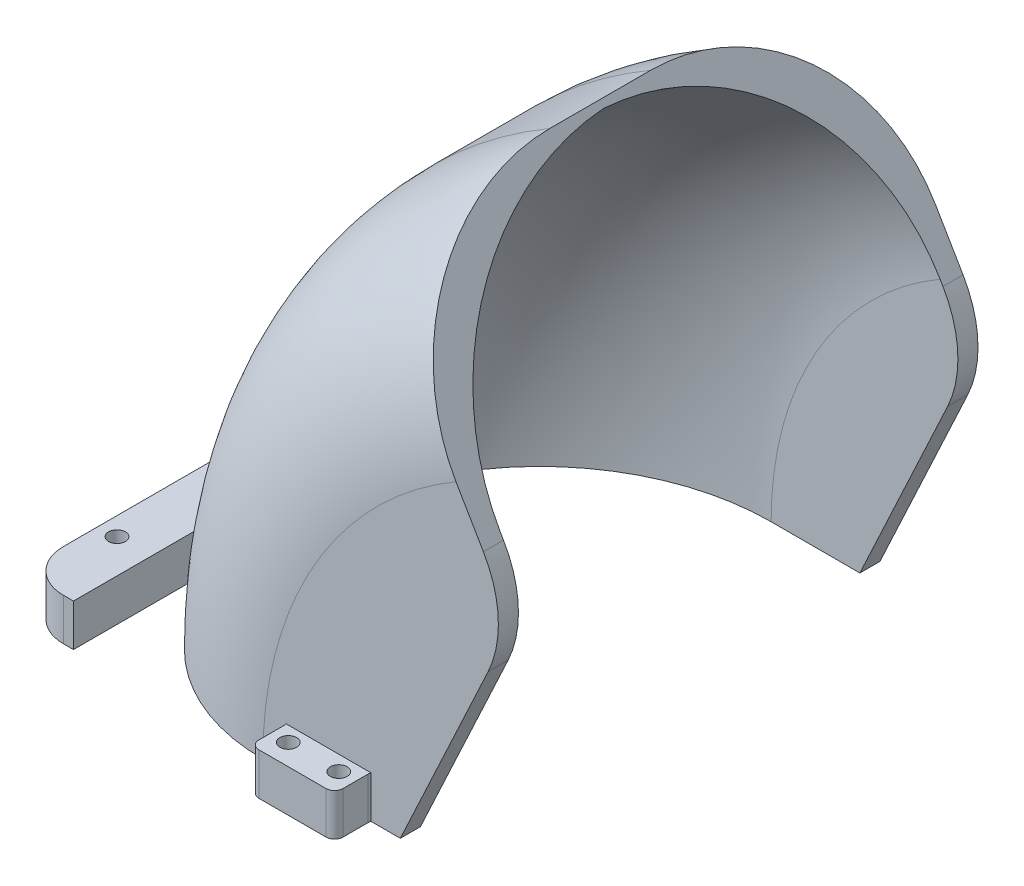
from build123d import *

# Parameters (mm, degrees)
BOSS_EXTRUDE1_DEPTH = 104.45
BOSS_EXTRUDE2_DEPTH = 4.7752
BOSS_EXTRUDE3_START = 4.7752
BOSS_EXTRUDE3_DEPTH = 4.7752
SKETCH4_R           = 1.9999999999999967
SKETCH4_R_2         = 1.9999999999999962
BOSS_EXTRUDE4_DEPTH = 10
FILLET1_R           = 10
FILLET3_R           = 55
FILLET4_R           = 45
CHAMFER1_SIZE       = 60.00000000000001
CHAMFER1_SIZE2      = 66.13522872048569
FILLET5_R           = 26


with BuildPart() as part:
    # Sketch1 → Boss-Extrude1 (new body)
    with BuildSketch(Plane.XY):
        with BuildLine():
            Line((-137.69000000000003, 0), (-136.1, 0))
            ThreePointArc((-136.1, 0), (-118.0490106345522, 67.73212744483506), (-68.68426027621781, 117.49758461478588))
            Line((-68.68426027621781, 117.49758461478588), (-69.48667007665269, 118.87026029103507))
            ThreePointArc((-69.48667007665269, 118.87026029103507), (-119.42812839288389, 68.52341387126629), (-137.69000000000003, 0))
        make_face()
    extrude(amount=BOSS_EXTRUDE1_DEPTH)

    # Sketch2 → Boss-Extrude2 (add)
    with BuildSketch(Plane.XY.offset(104.45)):
        with BuildLine():
            Line((-137.69000000000003, 1.686e-14), (0, 0))
            Line((0, 0), (-69.48667007665271, 118.87026029103507))
            ThreePointArc((-69.48667007665271, 118.87026029103507), (-119.42812839288392, 68.5234138712663), (-137.69000000000003, 1.686e-14))
        make_face()
    extrude(amount=BOSS_EXTRUDE2_DEPTH)

    # Sketch3 → Boss-Extrude3 (add)
    with BuildSketch(Plane(origin=(0, 0, 0), x_dir=(-1, 0, 0), z_dir=(0, 0, -1)).offset(BOSS_EXTRUDE3_START)):
        with BuildLine():
            Line((0, 0), (137.69000000000003, 1.686e-14))
            ThreePointArc((137.69000000000003, 1.686e-14), (119.42812839288389, 68.52341387126629), (69.4866700766527, 118.87026029103508))
            Line((69.4866700766527, 118.87026029103508), (0, 0))
        make_face()
    extrude(amount=-BOSS_EXTRUDE3_DEPTH)

    # Sketch4 → Boss-Extrude4 (add)
    # profile 1 of 5: a face of its own
    with BuildSketch(Plane.XZ):
        with BuildLine():
            Line((-137.69000000000003, 6.328766650845793), (-137.69000000000003, 109.2252))
            Line((-137.69000000000003, 109.2252), (-150.10000000000002, 109.2252))
            Line((-150.10000000000002, 109.2252), (-150.10000000000002, 10.475690213138677))
            ThreePointArc((-150.10000000000002, 10.475690213138678), (-142.97351570054127, 11.159843802640754), (-137.69000000000005, 6.32876665084579))
        make_face()
        with Locations(Location((-145.76703973293544, 18.800000000059715, 0), (0, 0, 270))):
            Circle(SKETCH4_R, mode=Mode.SUBTRACT)
        with Locations(Location((-145.76703973293542, 66.8000000000597, 0), (0, 0, 270))):
            Circle(SKETCH4_R, mode=Mode.SUBTRACT)
        with Locations(Location((-145.7670397329354, 90.80000000005973, 0), (0, 0, 270))):
            Circle(SKETCH4_R, mode=Mode.SUBTRACT)
    # profile 2 of 5: a face of its own
    with BuildSketch(Plane.XZ):
        with BuildLine():
            ThreePointArc((-87.05969357051328, 109.79869615131716), (-87.0808016736092, 109.50888942519616), (-87.14368092736706, 109.22519999999997))
            Line((-87.14368092736706, 109.2252), (-66.97531486918743, 109.2252))
            ThreePointArc((-66.97531486918743, 109.22520000000003), (-67.03848645979555, 109.50951987797353), (-67.05969357051326, 109.80000000005735))
            Line((-67.05969357051326, 109.80000000005735), (-67.05969357051326, 115.80000000005734))
            ThreePointArc((-67.05969357051328, 115.80000000005734), (-67.64548000814017, 117.21421356243043), (-69.05969357051326, 117.80000000005734))
            Line((-69.05969357051326, 117.80000000005734), (-85.05969357051326, 117.80000000005734))
            ThreePointArc((-85.05969357051326, 117.80000000005734), (-86.47390713288635, 117.21421356243043), (-87.05969357051328, 115.80000000005734))
            Line((-87.05969357051328, 115.80000000005734), (-87.05969357051328, 109.79869615131716))
        make_face()
        with Locations(Location((-83.05969357051332, 112.8000000000573, 0), (0, 0, 270))):
            Circle(SKETCH4_R, mode=Mode.SUBTRACT)
        with Locations(Location((-71.05969357051333, 112.8000000000573, 0), (0, 0, 270))):
            Circle(SKETCH4_R, mode=Mode.SUBTRACT)
    # profile 3 of 5: a face of its own
    with BuildSketch(Plane.XZ):
        with BuildLine():
            Line((-137.69000000000003, -0.7287666507264419), (-137.69000000000003, 6.328766650845793))
            ThreePointArc((-137.69000000000005, 6.32876665084579), (-142.97351570054127, 11.159843802640754), (-150.10000000000002, 10.475690213138678))
            Line((-150.10000000000002, 10.475690213138677), (-150.10000000000002, -1.9248000000000047))
            Line((-150.10000000000002, -1.9248000000000043), (-138.32613724180214, -1.9248000000000043))
            ThreePointArc((-138.32613724180214, -1.924799999999971), (-137.98505690973883, -1.3390226215975511), (-137.69000000000005, -0.7287666507264476))
        make_face()
    # profile 4 of 5: a face of its own
    with BuildSketch(Plane.XZ):
        with BuildLine():
            add(Edge.make_bspline(
                [(-89.04570479198645, -6.19874157019467), (-88.86578961884237, -6.199999999942648), (-88.685869728687, -6.199999999942648)],
                knots=[4.705147792502203, 4.705147792502203, 4.705147792502203, 4.71238898038469, 4.71238898038469, 4.71238898038469], degree=2, weights=[1, 0.9999934456569163, 1]))
            Line((-88.685869728687, -6.199999999942648), (-65.0596935705133, -6.1999999999426825))
            ThreePointArc((-65.0596935705133, -6.1999999999426825), (-66.47390713288638, -6.7857864375695796), (-67.0596935705133, -8.199999999942657))
            Line((-67.0596935705133, -8.199999999942657), (-67.0596935705133, -14.199999999942719))
            ThreePointArc((-67.0596935705133, -14.199999999942719), (-67.64548000814021, -15.614213562315815), (-69.0596935705133, -16.19999999994272))
            Line((-69.0596935705133, -16.19999999994272), (-85.05969357051329, -16.199999999942712))
            ThreePointArc((-85.05969357051329, -16.199999999942712), (-86.4739071328864, -15.614213562315818), (-87.0596935705133, -14.199999999942714))
            Line((-87.0596935705133, -14.199999999942714), (-87.0596935705133, -8.19869615120245))
            ThreePointArc((-87.0596935705133, -8.19869615120245), (-87.64054213015943, -6.789435301837706), (-89.04570479198645, -6.19874157019467))
        make_face()
        with Locations(Location((-83.05969357051332, -11.199999999942742, 0), (0, 0, 270))):
            Circle(SKETCH4_R_2, mode=Mode.SUBTRACT)
        with Locations(Location((-71.05969357051333, -11.199999999942742, 0), (0, 0, 269.999999999))):
            Circle(SKETCH4_R_2, mode=Mode.SUBTRACT)
    # profile 5 of 5: a face of its own
    with BuildSketch(Plane.XZ):
        with BuildLine():
            Line((-66.97531486918743, 109.2252), (-87.14368092736706, 109.2252))
            ThreePointArc((-87.14368092736706, 109.22519999999997), (-87.85972630188988, 108.19866898049219), (-89.04570479198642, 107.79874157030937))
            add(Edge.make_bspline(
                [(-88.68586972868695, 107.80000000005735), (-88.86578961884233, 107.80000000005735), (-89.04570479198642, 107.79874157030937)],
                knots=[4.71238898038469, 4.71238898038469, 4.71238898038469, 4.719630168267177, 4.719630168267177, 4.719630168267177], degree=2, weights=[1, 0.9999934456569163, 1]))
            Line((-88.68586972868694, 107.80000000005735), (-65.05969357051326, 107.80000000005735))
            ThreePointArc((-65.05969357051326, 107.80000000005735), (-66.25351097696311, 108.19538166535676), (-66.97531486918743, 109.22520000000003))
        make_face()
    extrude(amount=-BOSS_EXTRUDE4_DEPTH)


with BuildPart() as boss_extrude4_piece_1:
    # of the separate pieces the step leaves, piece 1, a body of its own (boss_extrude4_pieces)
    add(part.part.solids().sort_by_distance((-68.684260276, 117.497584615, 0))[0])

    # Fillet3
    # the kernel refuses this fillet: 55 mm, written as the material it adds along each edge
    with BuildSketch(Plane(origin=(9.948e-14, -5.329e-14, 104.45), x_dir=(-1, 3.9e-16, 0), z_dir=(-3.9e-16, -1, 0))) as fillet3_piece_1:
        with BuildLine():
            CenterArc((136.10000000000014 - FILLET3_R, FILLET3_R), FILLET3_R, 270, 90)
            Line((136.10000000000014 - FILLET3_R, -1.421e-14), (136.10000000000014, 0))
            Line((136.10000000000014, 0), (136.10000000000014, FILLET3_R))
        make_face()
    revolve(axis=Axis((9.948e-14, -5.329e-14, 104.45), (0, 0, -1)), revolution_arc=59.69119827809603)
    with BuildSketch(Plane(origin=(9.948e-14, -5.329e-14, 0), x_dir=(-1, 3.9e-16, 0), z_dir=(-3.9e-16, -1, 0))) as fillet3_piece_2:
        with BuildLine():
            CenterArc((136.10000000000014 - FILLET3_R, -FILLET3_R), FILLET3_R, 0, 90)
            Line((136.10000000000014 - FILLET3_R, 7.11e-15), (136.10000000000014, 0))
            Line((136.10000000000014, 0), (136.10000000000014, -FILLET3_R))
        make_face()
    revolve(axis=Axis((9.948e-14, -5.329e-14, 0), (0, 0, -1)), revolution_arc=59.69119827809603)

    # Fillet4
    fillet4_edges = [boss_extrude4_piece_1.edges().sort_by_distance(p)[0] for p in [
        (-119.42812839288393, 68.52341387126631, 109.2252),
        (-119.4281283928839, 68.5234138712663, -4.7752),
    ]]
    fillet(fillet4_edges, radius=FILLET4_R)

    # Chamfer1
    chamfer1_edges = [boss_extrude4_piece_1.edges().sort_by_distance(p)[0] for p in [
        (0, 0, 106.83760000000001),
        (0, 0, -2.3876),
    ]]
    chamfer1_side = [boss_extrude4_piece_1.faces().sort_by_distance(p)[0] for p in [
        (-46.345000000000006, 5.68e-15, -2.9317462886429677),
    ]]
    chamfer(chamfer1_edges, length=CHAMFER1_SIZE, length2=CHAMFER1_SIZE2, reference=chamfer1_side[0])

    # Fillet5
    fillet5_edges = [boss_extrude4_piece_1.edges().sort_by_distance(p)[0] for p in [
        (-33.37582118196211, 57.09573572816664, 106.83760000000001),
        (-33.37582118196211, 57.09573572816664, -2.3876),
    ]]
    fillet(fillet5_edges, radius=FILLET5_R)


with BuildPart() as boss_extrude4_piece_2:
    # of the separate pieces the step leaves, piece 2, a body of its own (boss_extrude4_pieces)
    add(part.part.solids().sort_by_distance((-137.69, 10, 109.2252))[0])

    # Fillet1
    fillet1_edges = [boss_extrude4_piece_2.edges().sort_by_distance(p)[0] for p in [
        (-150.10000000000002, 5, 109.2252),
        (-150.10000000000002, 5, -1.9248000000000045),
    ]]
    fillet(fillet1_edges, radius=FILLET1_R)


with BuildPart() as boss_extrude4_piece_3:
    # of the separate pieces the step leaves, piece 3, a body of its own (boss_extrude4_pieces)
    add(part.part.solids().sort_by_distance((-89.045704792, 0, -6.19874157))[0])


solid = Compound([boss_extrude4_piece_1.part, boss_extrude4_piece_2.part, boss_extrude4_piece_3.part])
